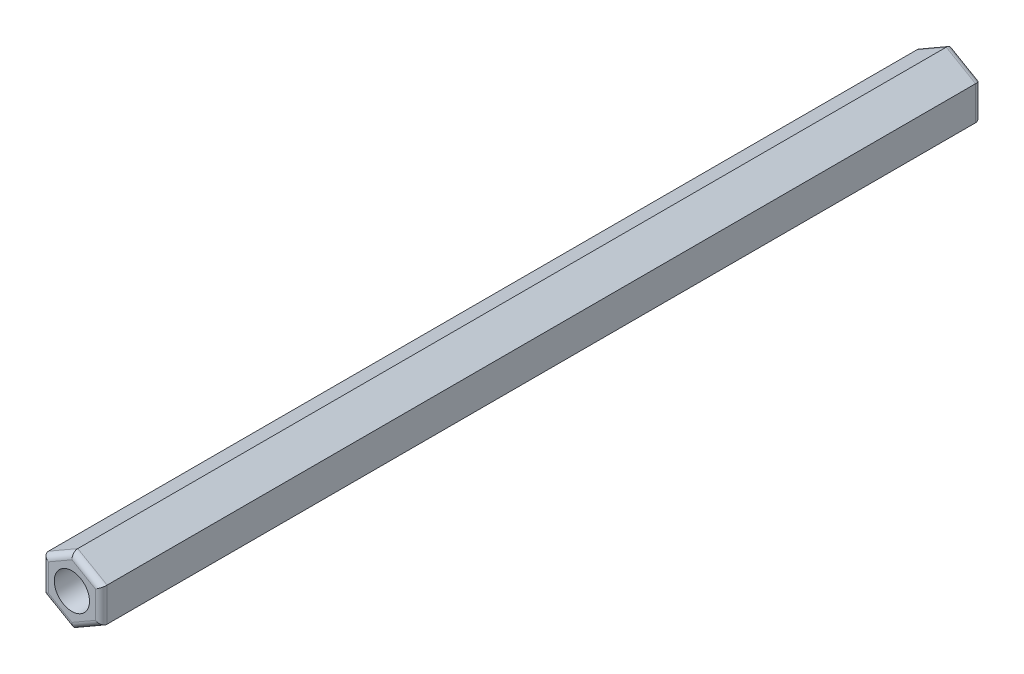
from build123d import *

# Parameters (mm, degrees)
RESSALTO_EXTRUS_O1_DEPTH = 75
FILETE1_R                = 0.5
ESBO_O2_R                = 1.5
CORTE_EXTRUS_O1_DEPTH    = 105.354641132


with BuildPart() as part:
    # Esboço1 → Ressalto-extrusão1 (new body)
    with BuildSketch(Plane(origin=(0, 0, 0), x_dir=(-1, 0, 0), z_dir=(0, 0, -1))):
        Polygon((67.502122675, -1.443375673), (70.002122675, -2.886751346), (72.502122675, -1.443375673), (72.502122675, 1.443375673), (70.002122675, 2.886751346), (67.502122675, 1.443375673), align=None)
    extrude(amount=-RESSALTO_EXTRUS_O1_DEPTH)

    # Filete1
    filete1_edges = [part.edges().sort_by_distance(p)[0] for p in [
        (-71.252122675, 2.165063509, 0),
        (-72.502122675, 0, 0),
        (-68.752122675, 2.165063509, 0),
        (-71.252122675, -2.165063509, 0),
        (-67.502122675, 0, 0),
        (-68.752122675, -2.165063509, 0),
        (-71.252122675, 2.165063509, 75),
        (-72.502122675, 0, 75),
        (-68.752122675, 2.165063509, 75),
        (-71.252122675, -2.165063509, 75),
        (-67.502122675, 0, 75),
        (-68.752122675, -2.165063509, 75),
    ]]
    fillet(filete1_edges, radius=FILETE1_R)

    # Esboço2 → Corte-extrusão1 (cut, through all)
    with BuildSketch(Plane.XY.offset(75)):
        with Locations((-70.002122675, 0)):
            Circle(ESBO_O2_R)
    extrude(amount=-CORTE_EXTRUS_O1_DEPTH, mode=Mode.SUBTRACT)


solid = part.part
